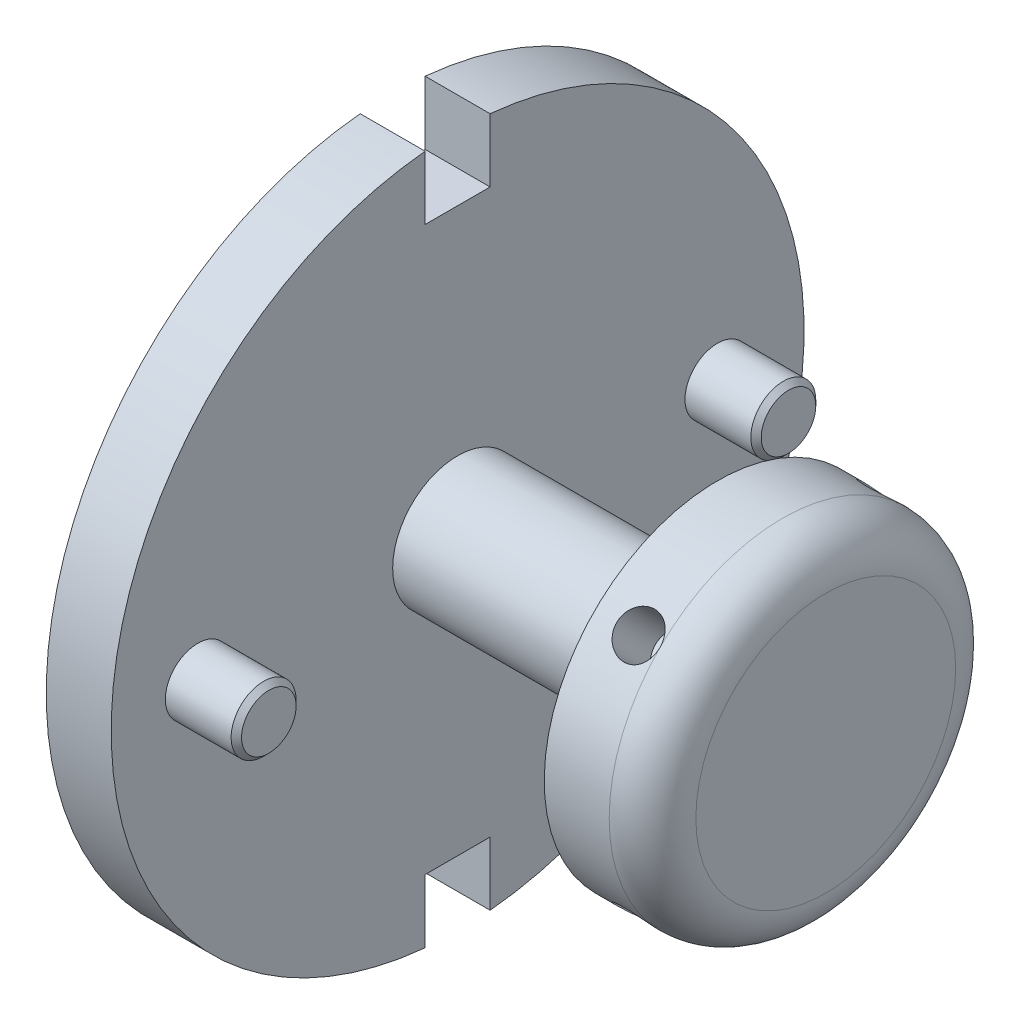
from build123d import *

# Parameters (mm, degrees)
BOSS_EXTRUDE1_DEPTH          = 19.05
SKETCH1_3_R                  = 9.525
BOSS_EXTRUDE2_DEPTH          = 20.828
CHAMFER1_SIZE                = 1.524
BOSS_EXTRUDE3_START          = -19.05
SKETCH1_4_R                  = 19.05
BOSS_EXTRUDE3_DEPTH          = 44.45
BOSS_EXTRUDE4_START          = -19.05
SKETCH1_6_R                  = 25.4
SKETCH1_6_R_2                = 19.05
BOSS_EXTRUDE4_DEPTH          = 19.05
BOSS_EXTRUDE5_START          = 76.2
SKETCH1_7_R                  = 19.05
BOSS_EXTRUDE5_DEPTH          = 76.2
BOSS_EXTRUDE6_START          = 107.95
SKETCH1_8_R                  = 50.8
SKETCH1_8_R_2                = 25.4
SKETCH1_8_R_3                = 19.05
BOSS_EXTRUDE6_DEPTH          = 31.75
CIRPATTERN2_COUNT            = 2
CHAMFER1_OF_CIRPATTERN2_SIZE = 1.524
FILLET1_R                    = 12.7
CUT_REVOLVE1_START           = 34.798
CUT_REVOLVE1_OUTLINE_R       = 6.35
CUT_REVOLVE1_DEPTH           = 16.0020001
CIRPATTERN3_COUNT            = 4


# Read off the part's stored shape, not the designer's step: Cut-Revolve1
with BuildPart() as part:
    # Sketch1 → Boss-Extrude1 (new body)
    with BuildSketch(Plane.YZ):
        with BuildLine():
            ThreePointArc((-101.152530245, -9.525), (0, -101.6), (101.152530245, -9.525))
            Line((101.152530245, -9.525), (82.55, -9.525))
            Line((82.55, -9.525), (82.55, 9.525))
            Line((82.55, 9.525), (101.152530245, 9.525))
            ThreePointArc((101.152530245, 9.525), (0, 101.6), (-101.152530245, 9.525))
            Line((-101.152530245, 9.525), (-82.55, 9.525))
            Line((-82.55, 9.525), (-82.55, -9.525))
            Line((-82.55, -9.525), (-101.152530245, -9.525))
        make_face()
    extrude(amount=-BOSS_EXTRUDE1_DEPTH)

    # Sketch1<3> → Boss-Extrude2 (add)
    with BuildSketch(Plane.YZ):
        with Locations(Location((0, 76.2, 0), (0, 0, 270))):
            Circle(SKETCH1_3_R)
    boss_extrude2 = extrude(amount=BOSS_EXTRUDE2_DEPTH)

    # Chamfer1
    chamfer1_edges = [part.edges().sort_by_distance(p)[0] for p in [
        (20.828, 0, 85.725),
    ]]
    chamfer(chamfer1_edges, length=CHAMFER1_SIZE)

    # Sketch1<4> → Boss-Extrude3 (add)
    with BuildSketch(Plane.YZ.offset(BOSS_EXTRUDE3_START)):
        with Locations(Location((0, 0, 0), (0, 0, 270))):
            Circle(SKETCH1_4_R)
    extrude(amount=-BOSS_EXTRUDE3_DEPTH)

    # Sketch1<6> → Boss-Extrude4 (add)
    with BuildSketch(Plane.YZ.offset(BOSS_EXTRUDE4_START)):
        with Locations(Location((0, 0, 0), (0, 0, 90))):
            Circle(SKETCH1_6_R)
        with Locations(Location((0, 0, 0), (0, 0, 270))):
            Circle(SKETCH1_6_R_2, mode=Mode.SUBTRACT)
    extrude(amount=-BOSS_EXTRUDE4_DEPTH)

    # Sketch1<7> → Boss-Extrude5 (add)
    with BuildSketch(Plane.YZ.offset(BOSS_EXTRUDE5_START)):
        with Locations(Location((0, 0, 0), (0, 0, 270))):
            Circle(SKETCH1_7_R)
    extrude(amount=-BOSS_EXTRUDE5_DEPTH)

    # Sketch1<8> → Boss-Extrude6 (add)
    # profile 1 of 3: a face of its own
    with BuildSketch(Plane.YZ.offset(BOSS_EXTRUDE6_START)):
        with Locations(Location((0, 0, 0), (0, 0, 270))):
            Circle(SKETCH1_8_R)
        with Locations(Location((0, 0, 0), (0, 0, 90))):
            Circle(SKETCH1_8_R_2, mode=Mode.SUBTRACT)
    # profile 2 of 3: a face of its own
    with BuildSketch(Plane.YZ.offset(BOSS_EXTRUDE6_START)):
        with Locations(Location((0, 0, 0), (0, 0, 90))):
            Circle(SKETCH1_8_R_2)
        with Locations(Location((0, 0, 0), (0, 0, 270))):
            Circle(SKETCH1_8_R_3, mode=Mode.SUBTRACT)
    # profile 3 of 3: a face of its own
    with BuildSketch(Plane.YZ.offset(BOSS_EXTRUDE6_START)):
        with Locations(Location((0, 0, 0), (0, 0, 270))):
            Circle(SKETCH1_8_R_3)
    extrude(amount=-BOSS_EXTRUDE6_DEPTH)

    # CirPattern2: Boss-Extrude2 ×2 about axis
    cirpattern2_axis = Axis((0, 0, 0), (1, 0, 0))
    for i in range(1, CIRPATTERN2_COUNT):
        add(boss_extrude2.rotate(cirpattern2_axis, i * 360 / CIRPATTERN2_COUNT))

    # Chamfer1 of CirPattern2
    chamfer1_of_cirpattern2_edges = [part.edges().sort_by_distance(p)[0] for p in [
        (20.828, 0, -85.725),
    ]]
    chamfer(chamfer1_of_cirpattern2_edges, length=CHAMFER1_OF_CIRPATTERN2_SIZE)

    # Fillet1
    fillet1_edges = [part.edges().sort_by_distance(p)[0] for p in [
        (107.95, 0, 50.8),
    ]]
    fillet(fillet1_edges, radius=FILLET1_R)

    # Cut-Revolve1 outline → Cut-Revolve1 (cut)
    with BuildSketch(Plane(origin=(0, 0, 0), x_dir=(1, 0, 0), z_dir=(0, 0.707106781186549, -0.707106781186546)).offset(CUT_REVOLVE1_START)):
        with Locations((88.9, 0)):
            Circle(CUT_REVOLVE1_OUTLINE_R)
    cut_revolve1 = extrude(amount=CUT_REVOLVE1_DEPTH, mode=Mode.SUBTRACT)

    # CirPattern3: Cut-Revolve1 ×4 about axis
    cirpattern3_axis = Axis((0, 0, 0), (1, 0, 0))
    for i in range(1, CIRPATTERN3_COUNT):
        add(cut_revolve1.rotate(cirpattern3_axis, i * 360 / CIRPATTERN3_COUNT), mode=Mode.SUBTRACT)


solid = part.part
